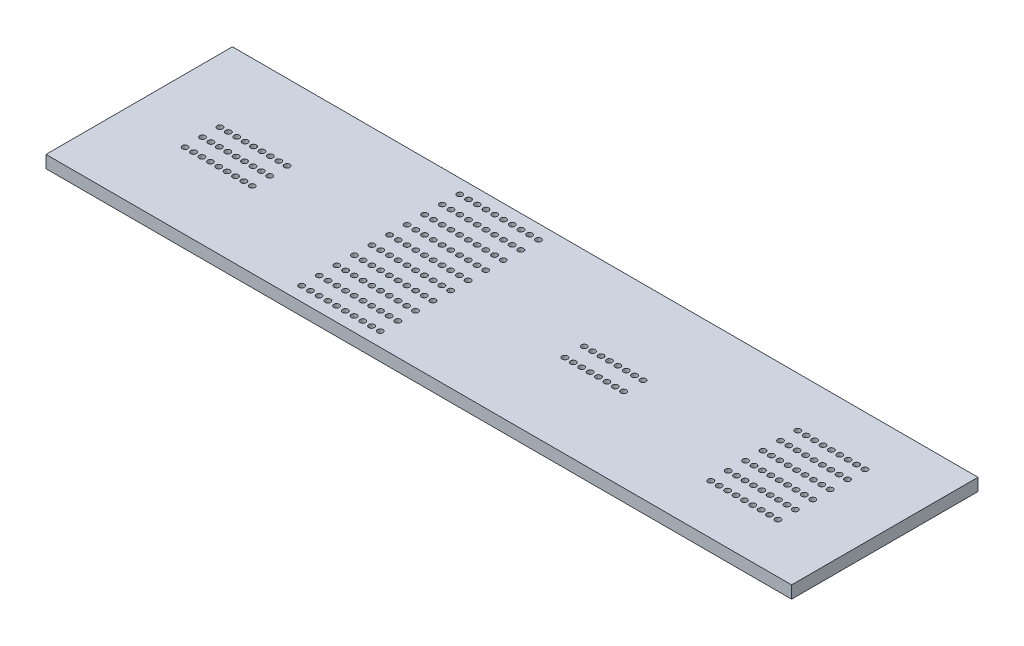
from build123d import *

# Parameters (mm, degrees)
ESQUISSE2_W                     = 120
ESQUISSE2_H                     = 30
BOSS_EXTRU_1_DEPTH              = 2
ENL_V_MAT_EXTRU_3_REACH         = 63.879
ESQUISSE8_R                     = 0.45
R_P_TITION_LIN_AIRE4_COUNT      = 9
R_P_TITION_LIN_AIRE4_PITCH      = 1.35
R_P_TITION_LIN_AIRE4_COUNT_DIR2 = 3
R_P_TITION_LIN_AIRE4_PITCH_DIR2 = 2.8
ENL_V_MAT_EXTRU_4_REACH         = 63.879
ESQUISSE10_R                    = 0.45
R_P_TITION_LIN_AIRE5_COUNT      = 10
R_P_TITION_LIN_AIRE5_PITCH      = 1.406
R_P_TITION_LIN_AIRE5_COUNT_DIR2 = 10
R_P_TITION_LIN_AIRE5_PITCH_DIR2 = 2.827777778
ENL_V_MAT_EXTRU_5_REACH         = 63.879
ESQUISSE12_R                    = 0.45
R_P_TITION_LIN_AIRE6_COUNT      = 8
R_P_TITION_LIN_AIRE6_PITCH      = 1.35
R_P_TITION_LIN_AIRE6_COUNT_DIR2 = 2
R_P_TITION_LIN_AIRE6_PITCH_DIR2 = 3.111
ENL_V_MAT_EXTRU_6_REACH         = 63.879
ESQUISSE14_R                    = 0.45
R_P_TITION_LIN_AIRE7_COUNT      = 9
R_P_TITION_LIN_AIRE7_PITCH      = 1.35
R_P_TITION_LIN_AIRE7_COUNT_DIR2 = 6
R_P_TITION_LIN_AIRE7_PITCH_DIR2 = 2.8


with BuildPart() as part:
    # Esquisse2 → Boss.-Extru.1 (new body)
    with BuildSketch(Plane(origin=(0, 0, 0), x_dir=(1, 0, 0), z_dir=(0, 1, 0))):
        Rectangle(ESQUISSE2_W, ESQUISSE2_H)
    extrude(amount=BOSS_EXTRU_1_DEPTH)

    # Esquisse8 → Enlèv. mat.-Extru.3 (cut, up to next)
    with BuildSketch(Plane(origin=(0, 2, 0), x_dir=(1, 0, 0), z_dir=(0, 1, 0)), mode=Mode.PRIVATE) as enl_v_mat_extru_3_sk1:
        with Locations((-49.8, 2.8)):
            Circle(ESQUISSE8_R)
    enl_v_mat_extru_3_tool1 = extrude(enl_v_mat_extru_3_sk1.sketch, amount=-ENL_V_MAT_EXTRU_3_REACH, mode=Mode.PRIVATE) & part.part
    enl_v_mat_extru_3 = enl_v_mat_extru_3_tool1.solids().sort_by_distance((-49.8, 2, -2.8))[0]
    add(enl_v_mat_extru_3, mode=Mode.SUBTRACT)

    # Répétition linéaire4: Enl_v. mat.-Extru.3 9 × 3
    with Locations(*[(i * R_P_TITION_LIN_AIRE4_PITCH, 0, j * R_P_TITION_LIN_AIRE4_PITCH_DIR2) for i in range(R_P_TITION_LIN_AIRE4_COUNT) for j in range(R_P_TITION_LIN_AIRE4_COUNT_DIR2) if (i, j) != (0, 0)]):
        add(enl_v_mat_extru_3, mode=Mode.SUBTRACT)

    # Esquisse10 → Enlèv. mat.-Extru.4 (cut, up to next)
    with BuildSketch(Plane(origin=(0, 2, 0), x_dir=(1, 0, 0), z_dir=(0, 1, 0)), mode=Mode.PRIVATE) as enl_v_mat_extru_4_sk1:
        with Locations((-21.127, 12.725)):
            Circle(ESQUISSE10_R)
    enl_v_mat_extru_4_tool1 = extrude(enl_v_mat_extru_4_sk1.sketch, amount=-ENL_V_MAT_EXTRU_4_REACH, mode=Mode.PRIVATE) & part.part
    enl_v_mat_extru_4 = enl_v_mat_extru_4_tool1.solids().sort_by_distance((-21.127, 2, -12.725))[0]
    add(enl_v_mat_extru_4, mode=Mode.SUBTRACT)

    # Répétition linéaire5: Enl_v. mat.-Extru.4 10 × 10
    with Locations(*[(i * R_P_TITION_LIN_AIRE5_PITCH, 0, j * R_P_TITION_LIN_AIRE5_PITCH_DIR2) for i in range(R_P_TITION_LIN_AIRE5_COUNT) for j in range(R_P_TITION_LIN_AIRE5_COUNT_DIR2) if (i, j) != (0, 0)]):
        add(enl_v_mat_extru_4, mode=Mode.SUBTRACT)

    # Esquisse12 → Enlèv. mat.-Extru.5 (cut, up to next)
    with BuildSketch(Plane(origin=(0, 2, 0), x_dir=(1, 0, 0), z_dir=(0, 1, 0)), mode=Mode.PRIVATE) as enl_v_mat_extru_5_sk1:
        with Locations((10.075, 1.5555)):
            Circle(ESQUISSE12_R)
    enl_v_mat_extru_5_tool1 = extrude(enl_v_mat_extru_5_sk1.sketch, amount=-ENL_V_MAT_EXTRU_5_REACH, mode=Mode.PRIVATE) & part.part
    enl_v_mat_extru_5 = enl_v_mat_extru_5_tool1.solids().sort_by_distance((10.075, 2, -1.5555))[0]
    add(enl_v_mat_extru_5, mode=Mode.SUBTRACT)

    # Répétition linéaire6: Enl_v. mat.-Extru.5 8 × 2
    with Locations(*[(i * R_P_TITION_LIN_AIRE6_PITCH, 0, j * R_P_TITION_LIN_AIRE6_PITCH_DIR2) for i in range(R_P_TITION_LIN_AIRE6_COUNT) for j in range(R_P_TITION_LIN_AIRE6_COUNT_DIR2) if (i, j) != (0, 0)]):
        add(enl_v_mat_extru_5, mode=Mode.SUBTRACT)

    # Esquisse14 → Enlèv. mat.-Extru.6 (cut, up to next)
    with BuildSketch(Plane(origin=(0, 2, 0), x_dir=(1, 0, 0), z_dir=(0, 1, 0)), mode=Mode.PRIVATE) as enl_v_mat_extru_6_sk1:
        with Locations((39, 7)):
            Circle(ESQUISSE14_R)
    enl_v_mat_extru_6_tool1 = extrude(enl_v_mat_extru_6_sk1.sketch, amount=-ENL_V_MAT_EXTRU_6_REACH, mode=Mode.PRIVATE) & part.part
    enl_v_mat_extru_6 = enl_v_mat_extru_6_tool1.solids().sort_by_distance((39, 2, -7))[0]
    add(enl_v_mat_extru_6, mode=Mode.SUBTRACT)

    # Répétition linéaire7: Enl_v. mat.-Extru.6 9 × 6
    with Locations(*[(i * R_P_TITION_LIN_AIRE7_PITCH, 0, j * R_P_TITION_LIN_AIRE7_PITCH_DIR2) for i in range(R_P_TITION_LIN_AIRE7_COUNT) for j in range(R_P_TITION_LIN_AIRE7_COUNT_DIR2) if (i, j) != (0, 0)]):
        add(enl_v_mat_extru_6, mode=Mode.SUBTRACT)


solid = part.part
